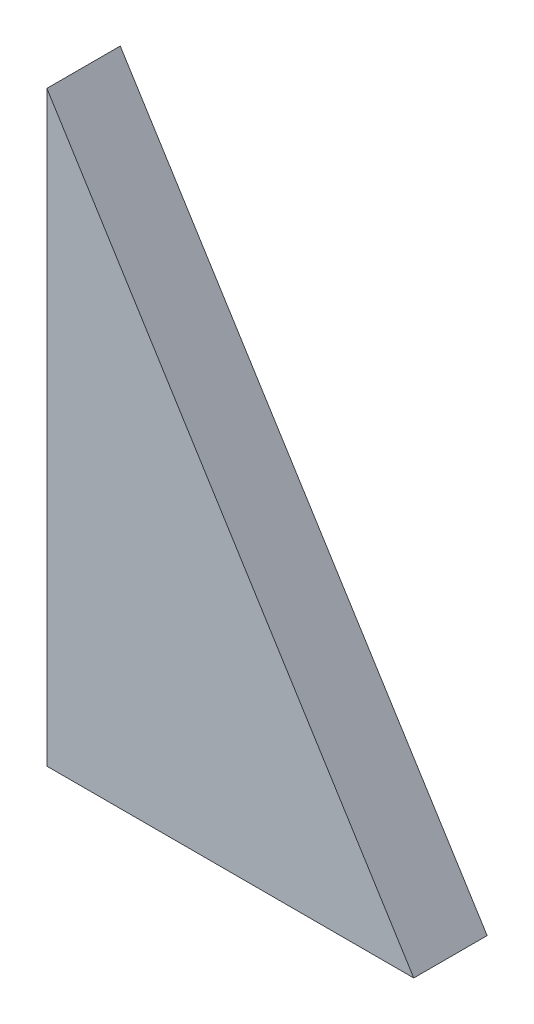
from build123d import *

# Parameters (mm, degrees)
SKETCH1_W               = 31.75
SKETCH1_H               = 50.8
BOSS_EXTRUDE1_DEPTH     = 6.35
CUT_EXTRUDE1_DEPTH      = 31.618591166
CUT_EXTRUDE1_DEPTH_BACK = 31.618591166


with BuildPart() as part:
    # Sketch1 → Boss-Extrude1 (new body)
    with BuildSketch(Plane.XY):
        Rectangle(SKETCH1_W, SKETCH1_H)
    extrude(amount=BOSS_EXTRUDE1_DEPTH)

    # Sketch3 → Cut-Extrude1 (cut, two sides: drawn at the far end of the back side and taken through both)
    with BuildSketch(Plane.XY.offset(6.35).offset(-CUT_EXTRUDE1_DEPTH_BACK)):
        Polygon((-84.6749894, 135.47998304), (-15.875, 25.4), (15.875, -25.4), (84.6749894, -135.47998304), (304.83495548, 2.11999576), (135.48497668, 273.07996184), align=None)
    extrude(amount=CUT_EXTRUDE1_DEPTH + CUT_EXTRUDE1_DEPTH_BACK, mode=Mode.SUBTRACT)


solid = part.part
